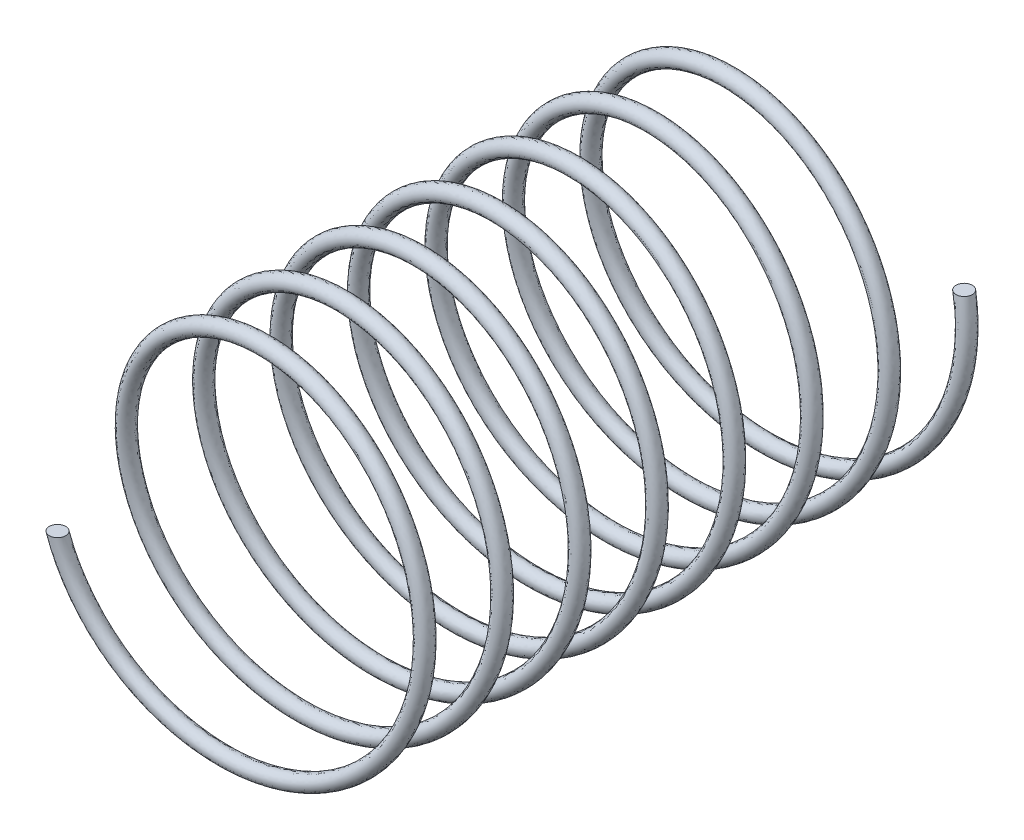
from build123d import *

# Parameters (mm, degrees)
SWEEP1_PITCH = 19


with BuildPart() as part:
    # Sweep1: the profile of Sketch2 screwed along a left-hand helix of 7.5 turns, 20 arcs to a turn; built about Z, then put on its axis
    sweep1_z = Axis((0, 0, 0), (0, 0, 1))
    sweep1_corners = [(42, 10, 0), (40, 10, -2), (38, 10, 0), (40, 10, 2)]
    with BuildLine(mode=Mode.PRIVATE) as sweep1_profile:
        ThreePointArc((42, 10, 0), (41.414213562, 10, -1.414213562), (40, 10, -2))
        ThreePointArc((40, 10, -2), (38.585786438, 10, -1.414213562), (38, 10, 0))
        ThreePointArc((38, 10, 0), (38.585786438, 10, 1.414213562), (40, 10, 2))
        ThreePointArc((40, 10, 2), (41.414213562, 10, 1.414213562), (42, 10, 0))
    sweep1_cap = Face(sweep1_profile.wire())
    sweep1_arcs = [((42, 10, 0), (42, 10, -2), (40, 10, -2), (1, 0.7071067811865476, 1)), ((40, 10, -2), (38, 10, -2), (38, 10, 0), (1, 0.7071067811865476, 1)), ((38, 10, 0), (38, 10, 2), (40, 10, 2), (1, 0.7071067811865476, 1)), ((40, 10, 2), (42, 10, 2), (42, 10, 0), (1, 0.7071067811865476, 1))]  # start, shoulder, end, weights
    sweep1_turn_angles = [0, -9, -18, -27, -36, -45, -54, -63, -72, -81, -90, -99, -108, -117, -126, -135, -144, -153, -162, -171, -180, -189, -198, -207, -216, -225, -234, -243, -252, -261, -270, -279, -288, -297, -306, -315, -324, -333, -342, -351, -360]
    sweep1_turn_weights = [1, 0.9876883405951378, 1, 0.9876883405951378, 1, 0.9876883405951378, 1, 0.9876883405951378, 1, 0.9876883405951378, 1, 0.9876883405951378, 1, 0.9876883405951378, 1, 0.9876883405951378, 1, 0.9876883405951378, 1, 0.9876883405951378, 1, 0.9876883405951378, 1, 0.9876883405951378, 1, 0.9876883405951378, 1, 0.9876883405951378, 1, 0.9876883405951378, 1, 0.9876883405951378, 1, 0.9876883405951378, 1, 0.9876883405951378, 1, 0.9876883405951378, 1, 0.9876883405951378, 1]
    sweep1_turn_sides = [Face.make_bezier_surface([[Vector(p[j][0], p[j][1], 0).rotate(sweep1_z, sweep1_turn_angles[2 * i + k]) / sweep1_turn_weights[2 * i + k] + Vector(0, 0, p[j][2] + -SWEEP1_PITCH * sweep1_turn_angles[2 * i + k] / 360) for k in range(3)] for j in range(3)], [[p[3][j] * sweep1_turn_weights[2 * i + k] for k in range(3)] for j in range(3)]) for p in sweep1_arcs for i in range(20)]
    sweep1_last_angles = [-2520, -2529, -2538, -2547, -2556, -2565, -2574, -2583, -2592, -2601, -2610, -2619, -2628, -2637, -2646, -2655, -2664, -2673, -2682, -2691, -2700]
    sweep1_last_weights = [1, 0.9876883405951378, 1, 0.9876883405951378, 1, 0.9876883405951378, 1, 0.9876883405951378, 1, 0.9876883405951378, 1, 0.9876883405951378, 1, 0.9876883405951378, 1, 0.9876883405951378, 1, 0.9876883405951378, 1, 0.9876883405950906, 1]
    sweep1_last_sides = [Face.make_bezier_surface([[Vector(p[j][0], p[j][1], 0).rotate(sweep1_z, sweep1_last_angles[2 * i + k]) / sweep1_last_weights[2 * i + k] + Vector(0, 0, p[j][2] + -SWEEP1_PITCH * sweep1_last_angles[2 * i + k] / 360) for k in range(3)] for j in range(3)], [[p[3][j] * sweep1_last_weights[2 * i + k] for k in range(3)] for j in range(3)]) for p in sweep1_arcs for i in range(10)]
    sweep1 = Plane(origin=(0, 0, 0), x_dir=(1, 0, 0), z_dir=(0, 0, 1)) * Solid(Shell([*[p.moved(Location((0, 0, SWEEP1_PITCH * i))) for i in range(7) for p in sweep1_turn_sides], *sweep1_last_sides, sweep1_cap, sweep1_cap.rotate(sweep1_z, -2700).moved(Location((0, 0, -SWEEP1_PITCH * -2700 / 360)))]))
    add(sweep1)


solid = part.part
